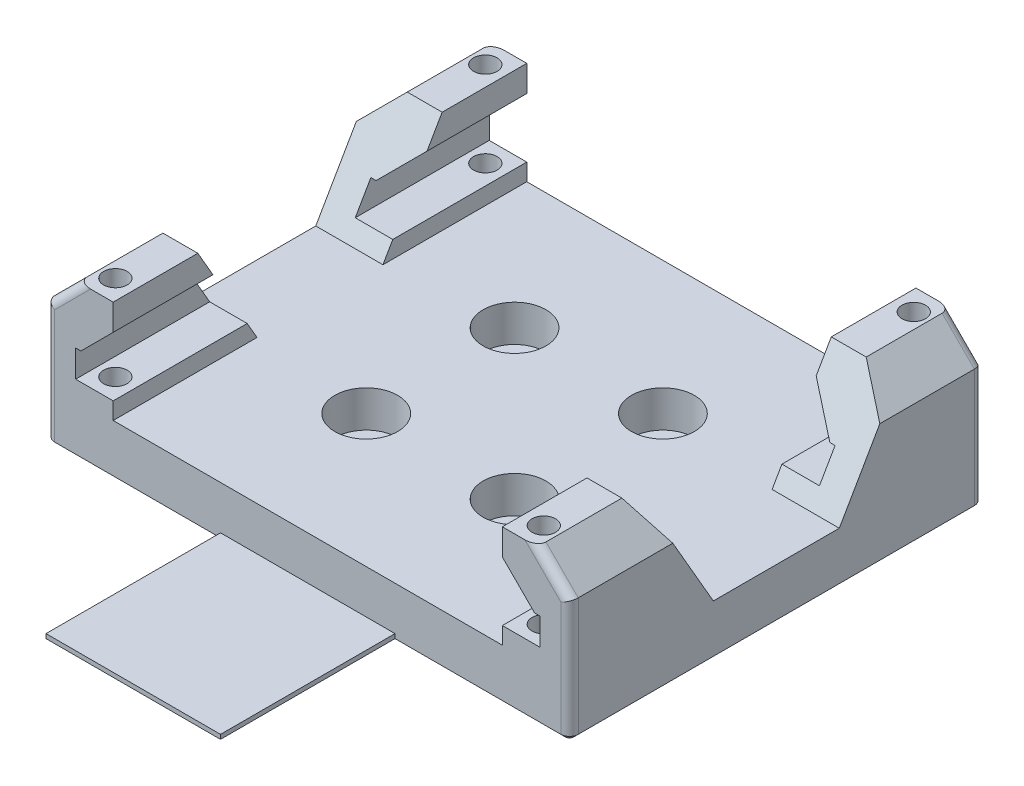
from build123d import *

# Parameters (mm, degrees)
BOSS_EXTRUDE1_DEPTH    = 46.39999966
SKETCH2_R              = 1.3500000000000056
SKETCH2_R_2            = 1.3500000000000065
SKETCH2_R_3            = 1.3500000000000034
CUT_EXTRUDE1_DEPTH     = 57.705554564416346
CUT_EXTRUDE2_DEPTH     = 57.705554564416346
CUT_EXTRUDE3_DEPTH     = 77.91241719292147
MOVE_FACE1_BY          = 0.5
MOVE_FACE1_2_BY        = 0.5
CUT_EXTRUDE5_DEPTH     = 0.5
CUT_EXTRUDE6_DEPTH     = 0.5
MOVE_START             = 2.95
MOVE_FACE2_OUTLINE_W   = 4.200000000000003
MOVE_FACE2_OUTLINE_H   = 47.399999660000006
MOVE_FACE2_OUTLINE_R   = 1.35
MOVE_FACE2_DEPTH       = 2
MOVE_FACE3_BY          = 2
MOVE_FACE4_BY          = 0.1
MOVE_FACE4_2_BY        = 0.1
MOVE_FACE4_3_BY        = 0.1
MOVE_FACE4_4_BY        = 0.1
SKETCH14_W             = 31.645569847246712
SKETCH14_H             = 25
BOSS_EXTRUDE4_DEPTH    = 4
SKETCH15_R             = 2.0999999999999974
SKETCH15_R_2           = 2.100000000000001
CUT_EXTRUDE9_DEPTH     = 59.74664856924181
SKETCH16_R             = 3.599999999999999
SKETCH16_R_2           = 3.600000000000001
SKETCH16_R_3           = 3.5999999999999996
CUT_EXTRUDE10_DEPTH    = 4.2
MOVE_START_2           = -6
MOVE_FACE5_OUTLINE_W   = 60.00000000000001
MOVE_FACE5_OUTLINE_H   = 47.399999660000006
MOVE_FACE5_OUTLINE_R   = 1.35
MOVE_FACE5_OUTLINE_W_2 = 31.645569848
MOVE_FACE5_OUTLINE_H_2 = 25.000000000000004
MOVE_FACE5_DEPTH       = 4
MOVE_FACE6_OUTLINE_W   = 60.00000000000001
MOVE_FACE6_OUTLINE_H   = 47.399999660000006
MOVE_FACE6_OUTLINE_R   = 1.35
MOVE_FACE6_OUTLINE_R_2 = 2.1
MOVE_FACE6_DEPTH       = 1
FILLET1_R              = 1
SKETCH18_W             = 20
SKETCH18_H             = 1
BOSS_EXTRUDE5_DEPTH    = 20
CHAMFER1_SIZE          = 0.5


# Read off the part's stored shape, not the designer's step: Move Face2, Move Face5, Move Face6
with BuildPart() as part:
    # Sketch1 → Boss-Extrude1 (new body)
    with BuildSketch(Plane.XY):
        Polygon((0, 0), (30.000000000000004, 0), (30.000000000000004, 12.749899999999984), (22.300099999999997, 12.749899999999984), (22.300099999999997, 9.749899999999984), (26, 6.050000000000002), (26, 4.950000000000001), (22.3, 4.95), (22.3, 1), (0, 1), align=None)
    extrude(amount=-BOSS_EXTRUDE1_DEPTH)

    # Mirror1: part across plane


with BuildPart() as part_1:
    add(part.part)
    add(part.part.mirror(Plane(origin=(0, 1, -46.39999966), x_dir=(0, 0, 1), z_dir=(-1, 0, 0))))

    # Sketch2 → Cut-Extrude1 (cut, through all)
    with BuildSketch(Plane(origin=(0, 12.749899999999984, 0), x_dir=(1, 0, 0), z_dir=(0, 1, 0))):
        with Locations(Location((-24.54999983142516, 1.9999999985748345, 0), (0, 0, 270))):
            Circle(SKETCH2_R)
        with Locations(Location((-24.54999983142517, 44.39999966142516, 0), (0, 0, 270))):
            Circle(SKETCH2_R_2)
        with Locations(Location((24.54999983142517, 1.9999999985748345, 0), (0, 0, 270))):
            Circle(SKETCH2_R)
        with Locations(Location((24.54999983142515, 44.39999966142516, 0), (0, 0, 270))):
            Circle(SKETCH2_R_3)
    extrude(amount=-CUT_EXTRUDE1_DEPTH, mode=Mode.SUBTRACT)

    # Sketch3 → Cut-Extrude2 (cut, through all)
    with BuildSketch(Plane.XY):
        Polygon((26.300000000000004, 12.749899999999984), (30.000000000000004, 9.049899999999985), (30.000000000000004, 12.749899999999984), align=None)
        Polygon((-30.000000000000004, 12.749899999999984), (-30.000000000000004, 9.049899999999981), (-26.300000000000004, 12.749899999999984), align=None)
    extrude(amount=-CUT_EXTRUDE2_DEPTH, mode=Mode.SUBTRACT)

    # Sketch4 → Cut-Extrude3 (cut, through all)
    with BuildSketch(Plane(origin=(30.000000000000004, 0, 0), x_dir=(0, 0, -1), z_dir=(1, 0, 0))):
        Polygon((9.199999829999998, 12.749899999999986), (37.199999829999996, 12.749899999999997), (30.41619190204875, 1.0000000000000036), (15.983807757951256, 0.9999999999999983), align=None)
    extrude(amount=-CUT_EXTRUDE3_DEPTH, mode=Mode.SUBTRACT)

    # Move Face1: a face moved outward by 0.5
    extrude(part_1.faces().sort_by_distance((-24, 3.187475, -46.39999966))[0], amount=MOVE_FACE1_BY, dir=(0, 0, -1))

    # Move Face1 2: a face moved outward by 0.5
    extrude(part_1.faces().sort_by_distance((-24, 3.187475, 0))[0], amount=MOVE_FACE1_2_BY, dir=(0, 0, 1))

    # Sketch6 → Cut-Extrude5 (cut)
    with BuildSketch(Plane(origin=(-26, 0, 0), x_dir=(0, 0, -1), z_dir=(1, 0, 0))):
        Polygon((13.703274194652213, 4.950000000000001), (13.068188898543607, 6.050000000000002), (-0.5000000000000004, 6.050000000000002), (-0.5000000000000004, 4.950000000000001), align=None)
        Polygon((33.33181076145639, 6.050000000000002), (32.69672546534779, 4.950000000000002), (46.89999966, 4.950000000000001), (46.89999966, 6.050000000000002), align=None)
    extrude(amount=-CUT_EXTRUDE5_DEPTH, mode=Mode.SUBTRACT)

    # Sketch7 → Cut-Extrude6 (cut)
    with BuildSketch(Plane.ZY.offset(-26)):
        Polygon((-13.068188898543607, 6.050000000000002), (-13.703274194652213, 4.950000000000001), (0.5000000000000004, 4.950000000000001), (0.5000000000000004, 6.050000000000002), align=None)
        Polygon((-32.69672546534779, 4.950000000000002), (-33.33181076145639, 6.050000000000002), (-46.89999966, 6.050000000000002), (-46.89999966, 4.950000000000001), align=None)
    extrude(amount=-CUT_EXTRUDE6_DEPTH, mode=Mode.SUBTRACT)

    # Move Face2 outline → Move Face2 (cut)
    # profile 1 of 2: a face of its own
    with BuildSketch(Plane(origin=(0, 0, 0), x_dir=(1, 0, 0), z_dir=(0, 1, 0)).offset(MOVE_START)):
        with Locations((-24.400000000000002, 23.199999830000003)):
            Rectangle(MOVE_FACE2_OUTLINE_W, MOVE_FACE2_OUTLINE_H)
        with Locations((-24.549999831, 1.999999999)):
            Circle(MOVE_FACE2_OUTLINE_R, mode=Mode.SUBTRACT)
        with Locations((-24.549999831, 44.399999661)):
            Circle(MOVE_FACE2_OUTLINE_R, mode=Mode.SUBTRACT)
    # profile 2 of 2: a face of its own
    with BuildSketch(Plane(origin=(0, 0, 0), x_dir=(1, 0, 0), z_dir=(0, 1, 0)).offset(MOVE_START)):
        with Locations((24.400000000000002, 23.199999830000003)):
            Rectangle(MOVE_FACE2_OUTLINE_W, MOVE_FACE2_OUTLINE_H)
        with Locations((24.549999831, 1.999999999)):
            Circle(MOVE_FACE2_OUTLINE_R, mode=Mode.SUBTRACT)
        with Locations((24.549999831, 44.399999661)):
            Circle(MOVE_FACE2_OUTLINE_R, mode=Mode.SUBTRACT)
    extrude(amount=MOVE_FACE2_DEPTH, mode=Mode.SUBTRACT)

    # Move Face3: a face moved outward by 2.0
    extrude(part_1.faces().sort_by_distance((0, 0, -23.19999983))[0], amount=MOVE_FACE3_BY, dir=(0, -1, 0))

    # Move Face4: a face moved inward by 0.1
    extrude(part_1.faces().sort_by_distance((-26.5, 4.468031617, -6.740769385))[0], amount=MOVE_FACE4_BY, dir=(-1, 0, 0), mode=Mode.SUBTRACT)

    # Move Face4 2: a face moved inward by 0.1
    extrude(part_1.faces().sort_by_distance((-26.5, 4.468031617, -39.659230275))[0], amount=MOVE_FACE4_2_BY, dir=(-1, 0, 0), mode=Mode.SUBTRACT)

    # Move Face4 3: a face moved inward by 0.1
    extrude(part_1.faces().sort_by_distance((26.5, 4.468031617, -6.740769385))[0], amount=MOVE_FACE4_3_BY, dir=(1, 0, 0), mode=Mode.SUBTRACT)

    # Move Face4 4: a face moved inward by 0.1
    extrude(part_1.faces().sort_by_distance((26.5, 4.468031617, -39.659230275))[0], amount=MOVE_FACE4_4_BY, dir=(1, 0, 0), mode=Mode.SUBTRACT)

    # Sketch14 → Boss-Extrude4 (add)
    with BuildSketch(Plane.XZ.offset(1.9999999999999996)):
        with Locations((-1.78e-15, -23.199999829999996)):
            Rectangle(SKETCH14_W, SKETCH14_H)
    extrude(amount=BOSS_EXTRUDE4_DEPTH)

    # Sketch15 → Cut-Extrude9 (cut, through all)
    with BuildSketch(Plane.XZ.offset(6)):
        with Locations(Location((-8.5, -14.699999829999992, 0), (0, 0, 270))):
            Circle(SKETCH15_R)
        with Locations(Location((8.5, -14.699999829999992, 0), (0, 0, 270))):
            Circle(SKETCH15_R)
        with Locations(Location((8.500000000000002, -31.699999829999992, 0), (0, 0, 270))):
            Circle(SKETCH15_R_2)
        with Locations(Location((-8.500000000000002, -31.699999829999992, 0), (0, 0, 270))):
            Circle(SKETCH15_R_2)
    extrude(amount=-CUT_EXTRUDE9_DEPTH, mode=Mode.SUBTRACT)

    # Sketch16 → Cut-Extrude10 (cut)
    with BuildSketch(Plane(origin=(0, 1, 0), x_dir=(1, 0, 0), z_dir=(0, 1, 0))):
        with Locations(Location((-8.500000000000002, 31.699999829999992, 0), (0, 0, 270))):
            Circle(SKETCH16_R)
        with Locations(Location((8.500000000000002, 31.699999829999992, 0), (0, 0, 270))):
            Circle(SKETCH16_R_2)
        with Locations(Location((8.5, 14.699999829999992, 0), (0, 0, 270))):
            Circle(SKETCH16_R_3)
        with Locations(Location((-8.5, 14.699999829999992, 0), (0, 0, 270))):
            Circle(SKETCH16_R_3)
    extrude(amount=-CUT_EXTRUDE10_DEPTH, mode=Mode.SUBTRACT)

    # Move Face5 outline → Move Face5 (add)
    with BuildSketch(Plane(origin=(0, 0, 0), x_dir=(1, 0, 0), z_dir=(0, 1, 0)).offset(MOVE_START_2)):
        with Locations((0, 23.199999830000003)):
            Rectangle(MOVE_FACE5_OUTLINE_W, MOVE_FACE5_OUTLINE_H)
        with Locations((-24.549999831, 1.999999999)):
            Circle(MOVE_FACE5_OUTLINE_R, mode=Mode.SUBTRACT)
        with Locations((24.549999831, 1.999999999)):
            Circle(MOVE_FACE5_OUTLINE_R, mode=Mode.SUBTRACT)
        with Locations((-24.549999831, 44.399999661)):
            Circle(MOVE_FACE5_OUTLINE_R, mode=Mode.SUBTRACT)
        with Locations((0, 23.199999830000003)):
            Rectangle(MOVE_FACE5_OUTLINE_W_2, MOVE_FACE5_OUTLINE_H_2, mode=Mode.SUBTRACT)
        with Locations((24.549999831, 44.399999661)):
            Circle(MOVE_FACE5_OUTLINE_R, mode=Mode.SUBTRACT)
    extrude(amount=MOVE_FACE5_DEPTH)

    # Move Face6 outline → Move Face6 (cut)
    with BuildSketch(Plane(origin=(0, 0, 0), x_dir=(1, 0, 0), z_dir=(0, 1, 0)).offset(MOVE_START_2)):
        with Locations((0, 23.199999830000003)):
            Rectangle(MOVE_FACE6_OUTLINE_W, MOVE_FACE6_OUTLINE_H)
        with Locations((-24.549999831, 1.999999999)):
            Circle(MOVE_FACE6_OUTLINE_R, mode=Mode.SUBTRACT)
        with Locations((-8.5, 14.69999983)):
            Circle(MOVE_FACE6_OUTLINE_R_2, mode=Mode.SUBTRACT)
        with Locations((24.549999831, 1.999999999)):
            Circle(MOVE_FACE6_OUTLINE_R, mode=Mode.SUBTRACT)
        with Locations((8.5, 14.69999983)):
            Circle(MOVE_FACE6_OUTLINE_R_2, mode=Mode.SUBTRACT)
        with Locations((-8.5, 31.69999983)):
            Circle(MOVE_FACE6_OUTLINE_R_2, mode=Mode.SUBTRACT)
        with Locations((-24.549999831, 44.399999661)):
            Circle(MOVE_FACE6_OUTLINE_R, mode=Mode.SUBTRACT)
        with Locations((8.5, 31.69999983)):
            Circle(MOVE_FACE6_OUTLINE_R_2, mode=Mode.SUBTRACT)
        with Locations((24.549999831, 44.399999661)):
            Circle(MOVE_FACE6_OUTLINE_R, mode=Mode.SUBTRACT)
    extrude(amount=MOVE_FACE6_DEPTH, mode=Mode.SUBTRACT)

    # Fillet1
    fillet1_edges = [part_1.edges().sort_by_distance(p)[0] for p in [
        (30.000000000000004, 2.0249499999999934, -46.89999966),
        (30.000000000000004, 2.0249499999999934, 0.5),
        (-30.000000000000004, 2.0249499999999907, 0.5),
        (-30.000000000000004, 2.02494999999999, -46.89999966),
        (28.150000000000006, 10.899899999999985, -46.899999660000006),
        (28.150000000000006, 10.899899999999985, 0.5),
        (-28.150000000000006, 10.899899999999983, -46.899999660000006),
        (-28.150000000000006, 10.899899999999983, 0.5),
    ]]
    fillet(fillet1_edges, radius=FILLET1_R)

    # Sketch18 → Boss-Extrude5 (add)
    with BuildSketch(Plane.XY.offset(0.5)):
        with Locations((0, -4.499999999999998)):
            Rectangle(SKETCH18_W, SKETCH18_H)
    extrude(amount=BOSS_EXTRUDE5_DEPTH)

    # Chamfer1
    chamfer1_edges = [part_1.edges().sort_by_distance(p)[0] for p in [
        (30, -5, -23.19999983),
        (0, -5, -46.89999966),
        (-19.5, -5, 0.5),
        (-30, -5, -23.19999983),
        (-29.707106781186546, -5, -46.607106441186545),
        (-29.707106781186543, -5, 0.20710678118654768),
        (29.707106781186546, -5, 0.20710678118654768),
        (29.707106781186546, -5, -46.607106441186545),
        (-10, -4.999999999999998, 10.5),
        (10, -4.999999999999998, 10.5),
        (0, -4.999999999999998, 20.5),
    ]]
    chamfer(chamfer1_edges, length=CHAMFER1_SIZE)


solid = part_1.part
